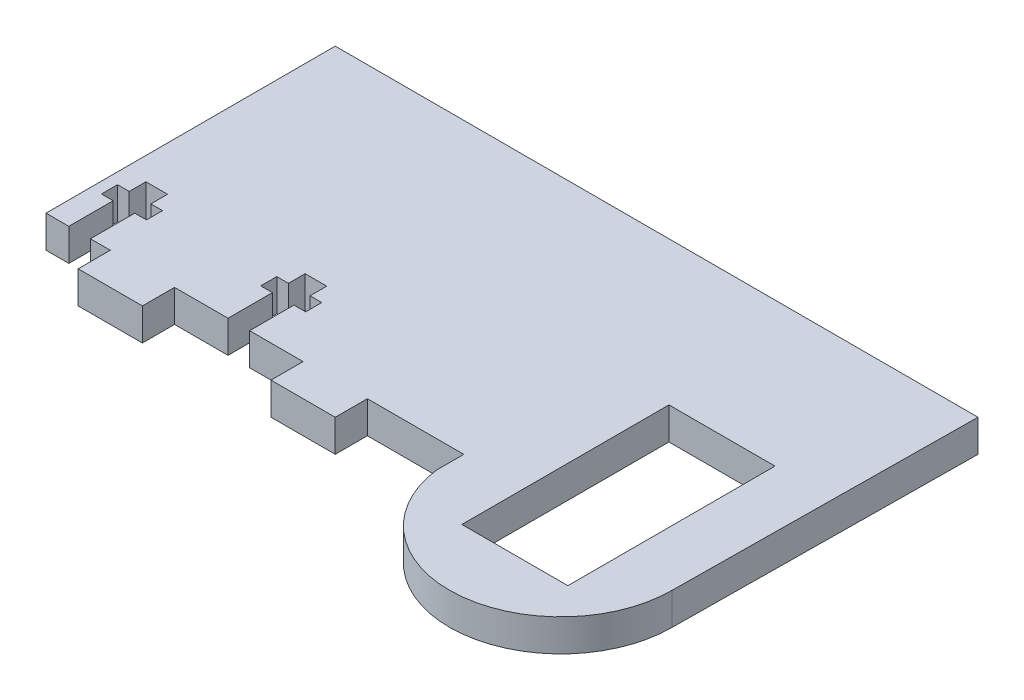
from build123d import *

# Parameters (mm, degrees)
BOSS_EXTRUDE1_DEPTH = 6.35
SKETCH4_W           = 20.950480973
SKETCH4_H           = 40.91890815
CUT_EXTRUDE2_DEPTH  = 79.730852648
CUT_EXTRUDE4_DEPTH  = 79.730852648
CUT_EXTRUDE5_DEPTH  = 79.730852648


with BuildPart() as part:
    # Sketch1 → Boss-Extrude1 (new body)
    with BuildSketch(Plane(origin=(0, 0, 0), x_dir=(1, 0, 0), z_dir=(0, 1, 0))):
        Polygon((64.810443043, 44.247385587), (64.810443043, -38.302614413), (20.360443043, -38.302614413), (20.360443043, -12.902614413), (1.310443043, -12.902614413), (1.310443043, -19.252614413), (-11.389556957, -19.252614413), (-11.389556957, -12.902614413), (-36.789556957, -12.902614413), (-36.789556957, -19.252614413), (-49.489556957, -19.252614413), (-49.489556957, -12.902614413), (-62.189556957, -12.902614413), (-62.189556957, 44.247385587), align=None)
    extrude(amount=BOSS_EXTRUDE1_DEPTH)

    # Sketch4 → Cut-Extrude2 (cut, through all)
    with BuildSketch(Plane.XZ):
        with Locations((42.642368246, 4.632403749)):
            Rectangle(SKETCH4_W, SKETCH4_H)
    extrude(amount=-CUT_EXTRUDE2_DEPTH, mode=Mode.SUBTRACT)

    # Sketch6 → Cut-Extrude4 (cut, through all)
    with BuildSketch(Plane(origin=(0, 6.35, 0), x_dir=(1, 0, 0), z_dir=(0, 1, 0))):
        Polygon((-57.68225551, -12.902614413), (-53.41505551, -12.902614413), (-53.41505551, -4.139614413), (-51.10365551, -4.139614413), (-51.10365551, -0.964614413), (-53.41505551, -0.964614413), (-53.41505551, 2.337385587), (-57.68225551, 2.337385587), (-57.68225551, -0.964614413), (-59.99365551, -0.964614413), (-59.99365551, -4.139614413), (-57.68225551, -4.139614413), align=None)
        Polygon((-26.223156957, -12.902614413), (-21.955956957, -12.902614413), (-21.955956957, -4.139614413), (-19.644556957, -4.139614413), (-19.644556957, -0.964614413), (-21.955956957, -0.964614413), (-21.955956957, 2.337385587), (-26.223156957, 2.337385587), (-26.223156957, -0.964614413), (-28.534556957, -0.964614413), (-28.534556957, -4.139614413), (-26.223156957, -4.139614413), align=None)
    extrude(amount=-CUT_EXTRUDE4_DEPTH, mode=Mode.SUBTRACT)

    # Sketch7 → Cut-Extrude5 (cut, through all)
    with BuildSketch(Plane(origin=(0, 6.35, 0), x_dir=(1, 0, 0), z_dir=(0, 1, 0))):
        with BuildLine():
            ThreePointArc((64.2017191, -15.566857824), (43.534706973, -37.527935207), (20.360443043, -18.231101235))
            Line((20.360443043, -18.231101235), (20.360443043, -38.302614413))
            Line((20.360443043, -38.302614413), (64.810443043, -38.302614413))
            Line((64.810443043, -38.302614413), (64.810443043, 44.247385587))
            Line((64.810443043, 44.247385587), (64.2017191, -15.566857824))
        make_face()
    extrude(amount=-CUT_EXTRUDE5_DEPTH, mode=Mode.SUBTRACT)


solid = part.part
